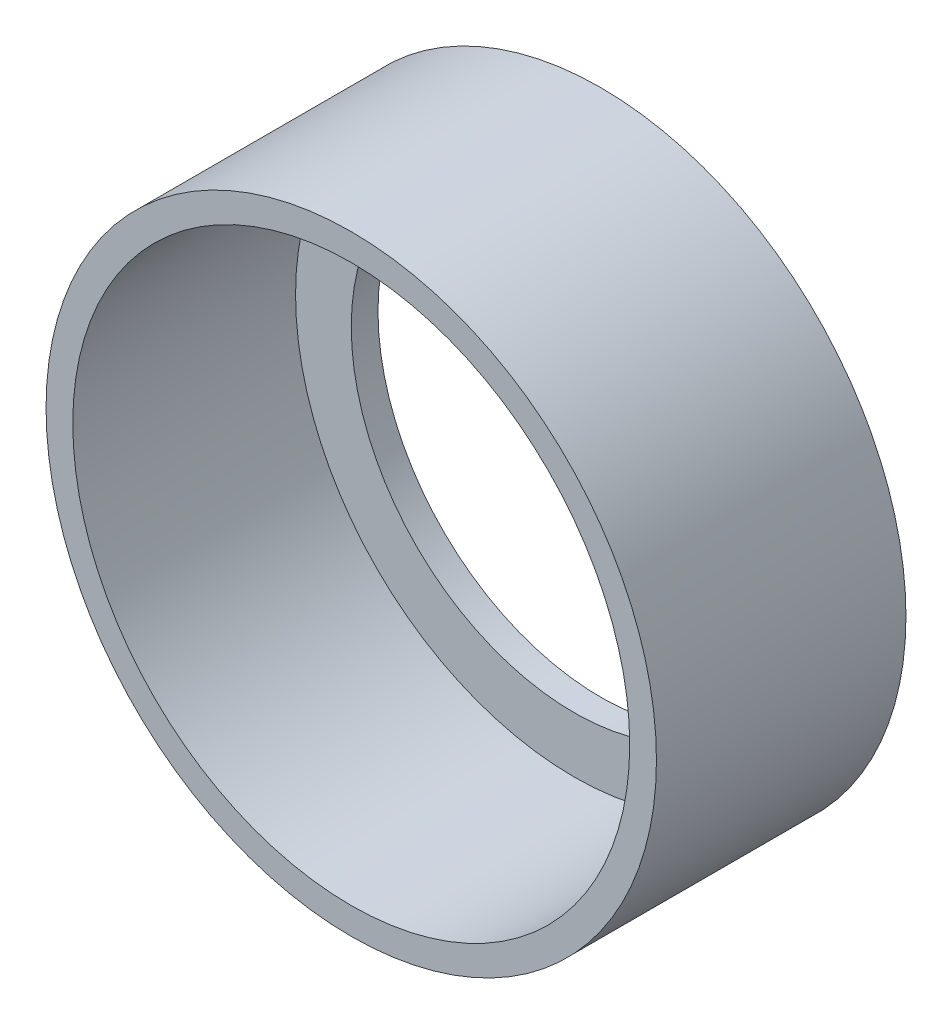
from build123d import *


with BuildPart() as part:
    # Sketch1 → Revolve1 (revolve)
    with BuildSketch(Plane(origin=(0, 0, 0), x_dir=(1, 0, 0), z_dir=(0, 1, 0))):
        Polygon((15.875, 5.425637802), (17.399, 5.425637802), (17.399, 19.649637802), (12.7, 19.649637802), (12.7, 18.125637802), (15.875, 18.125637802), align=None)
    revolve(axis=Axis((0, 0, -10.179008168), (0, 0, 1)))


solid = part.part
